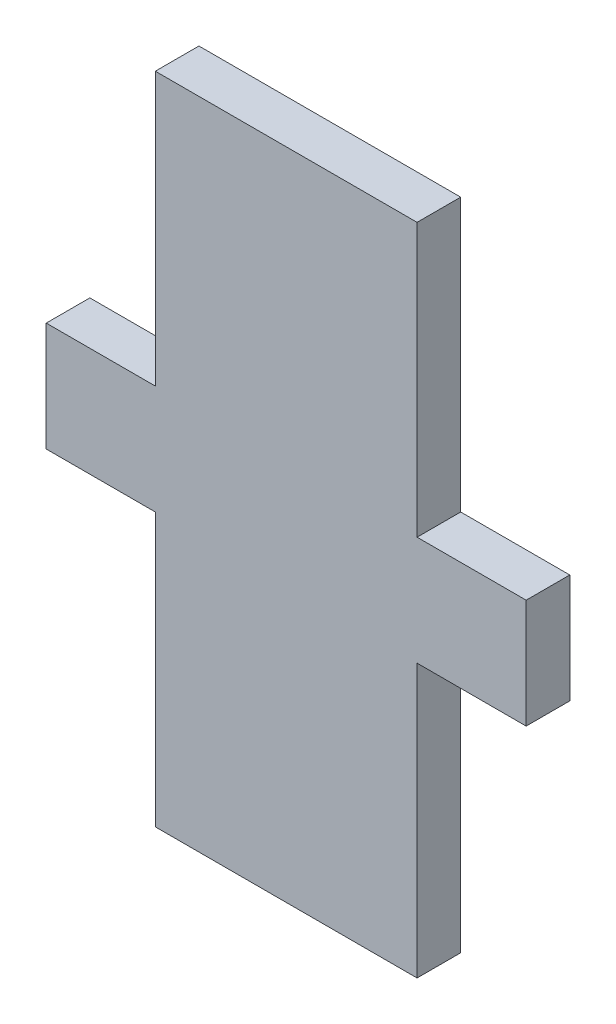
from build123d import *

# Parameters (mm, degrees)
SKETCH1_W           = 60
SKETCH1_H           = 150
BOSS_EXTRUDE1_DEPTH = 10
BOSS_EXTRUDE2_DEPTH = 10


with BuildPart() as part:
    # Sketch1 → Boss-Extrude1 (new body)
    with BuildSketch(Plane.XY):
        Rectangle(SKETCH1_W, SKETCH1_H)
    extrude(amount=-BOSS_EXTRUDE1_DEPTH)

    # Sketch2 → Boss-Extrude2 (add)
    with BuildSketch(Plane.XY):
        Polygon((-30, 12.5), (-30, -12.5), (-55, -12.5), (-55, 0), (-55, 12.5), align=None)
        Polygon((30, 12.5), (30, -12.5), (55, -12.5), (55, 0), (55, 12.5), align=None)
    extrude(amount=-BOSS_EXTRUDE2_DEPTH)


solid = part.part
